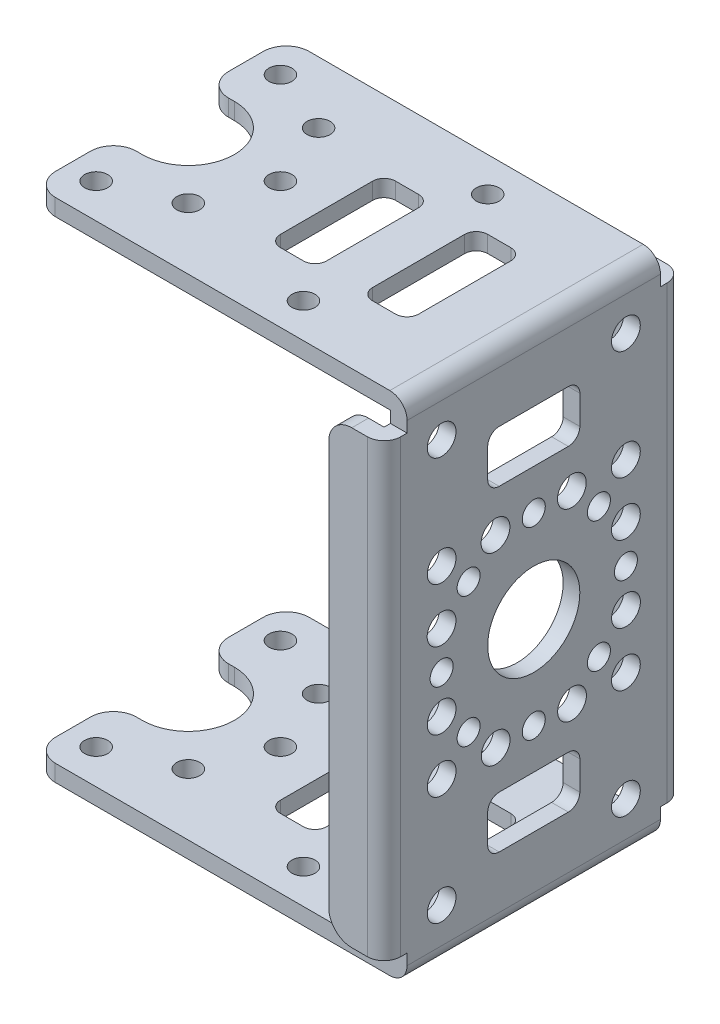
from build123d import *
from OCP.BRepAlgoAPI import BRepAlgoAPI_Cut
from OCP.TopTools import TopTools_ListOfShape

# Parameters (mm, degrees)
BOSS_EXTRUDE1_DEPTH = 11
SKETCH2_R           = 1
CUT_EXTRUDE1_DEPTH  = 49.17740653
SKETCH3_R           = 4
SKETCH3_R_2         = 1.25
SKETCH3_R_3         = 1
CUT_EXTRUDE3_DEPTH  = 56.793832843
BOSS_EXTRUDE2_DEPTH = 39.1
FILLET1_R           = 2
FILLET2_START       = -11
FILLET2_DEPTH       = 22.55
FILLET2_START_2     = -10.998352219
FILLET2_2_DEPTH     = 21.998352219
FILLET2_START_3     = -13
FILLET2_3_DEPTH     = 26
FILLET2_4_OUTLINE_W = 0.045411726
FILLET2_4_OUTLINE_H = 1
FILLET2_4_DEPTH     = 22


with BuildPart() as part:
    # Sketch1 → Boss-Extrude1 (new, symmetric)
    with BuildSketch(Plane.XY):
        Polygon((-16.25, 0), (16.25, 0), (16.25, 44), (-16.25, 44), (-16.25, 42.55), (14.8, 42.55), (14.8, 1.45), (-16.25, 1.45), align=None)
    extrude(amount=BOSS_EXTRUDE1_DEPTH, both=True)

    # Sketch2 → Cut-Extrude1 (cut, through all)
    with BuildSketch(Plane(origin=(0, 44, 0), x_dir=(1, 0, 0), z_dir=(0, 1, 0))):
        with BuildLine():
            Line((14.754588274, -11.001647781), (-14.245411726, -11.001647781))
            ThreePointArc((-14.245411726, -11.001647781), (-14.286004596, -11.001235793), (-14.326580741, -11))
            Line((-14.326580741, -11), (-16.25, -11))
            Line((-16.25, -11), (-16.25, 11))
            Line((-16.25, 11), (14.754588274, 11))
            Line((14.754588274, 11), (14.754588274, 13.363467794))
            Line((14.754588274, 13.363467794), (-19.651643458, 13.363467794))
            Line((-19.651643458, 13.363467794), (-19.651643458, -13.173756318))
            Line((-19.651643458, -13.173756318), (14.754588274, -13.173756318))
            Line((14.754588274, -13.173756318), (14.754588274, -11.001647781))
        make_face()
        with Locations(Location((-13.745411726, -8.001647781, 0), (0, 0, 180))):
            Circle(SKETCH2_R)
        with Locations(Location((-8.088557477, -5.658502031, 0), (0, 0, 180))):
            Circle(SKETCH2_R)
        with BuildLine():
            Line((1.254588274, 4.998352219), (-0.745411726, 4.998352219))
            ThreePointArc((-0.745411726, 4.998352219), (-1.452518507, 4.705459), (-1.745411726, 3.998352219))
            Line((-1.745411726, 3.998352219), (-1.745411726, -4.001647781))
            ThreePointArc((-1.745411726, -4.001647781), (-1.452518507, -4.708754562), (-0.745411726, -5.001647781))
            Line((-0.745411726, -5.001647781), (1.254588274, -5.001647781))
            ThreePointArc((1.254588274, -5.001647781), (1.961695055, -4.708754562), (2.254588274, -4.001647781))
            Line((2.254588274, -4.001647781), (2.254588274, 3.998352219))
            ThreePointArc((2.254588274, 3.998352219), (1.961695055, 4.705459), (1.254588274, 4.998352219))
        make_face()
        with BuildLine():
            Line((6.254588274, 3.998352219), (6.254588274, -4.001647781))
            ThreePointArc((6.254588274, -4.001647781), (6.547481493, -4.708754562), (7.254588274, -5.001647781))
            Line((7.254588274, -5.001647781), (9.254588274, -5.001647781))
            ThreePointArc((9.254588274, -5.001647781), (9.961695055, -4.708754562), (10.254588274, -4.001647781))
            Line((10.254588274, -4.001647781), (10.254588274, 3.998352219))
            ThreePointArc((10.254588274, 3.998352219), (9.961695055, 4.705459), (9.254588274, 4.998352219))
            Line((9.254588274, 4.998352219), (7.254588274, 4.998352219))
            ThreePointArc((7.254588274, 4.998352219), (6.547481493, 4.705459), (6.254588274, 3.998352219))
        make_face()
        with Locations(Location((4.254588274, -8.001647781, 0), (0, 0, 180))):
            Circle(SKETCH2_R)
        with Locations(Location((-5.745411726, -0.001647781, 0), (0, 0, 180))):
            Circle(SKETCH2_R)
        with Locations(Location((-8.088557477, 5.655206468, 0), (0, 0, 180))):
            Circle(SKETCH2_R)
        with Locations(Location((4.254588274, 7.998352219, 0), (0, 0, 180))):
            Circle(SKETCH2_R)
        with Locations(Location((-13.745411726, 7.998352219, 0), (0, 0, 180))):
            Circle(SKETCH2_R)
        with BuildLine():
            Line((-16.25, -11), (-14.326580741, -11))
            ThreePointArc((-14.326580741, -11), (-15.688037463, -10.386866531), (-16.245411726, -9.001647781))
            Line((-16.245411726, -9.001647781), (-16.245411726, -6.001647781))
            ThreePointArc((-16.245411726, -6.001647781), (-15.659625289, -4.587434219), (-14.245411726, -4.001647781))
            Line((-14.245411726, -4.001647781), (-13.745411726, -4.001647781))
            ThreePointArc((-13.745411726, -4.001647781), (-9.745411726, -0.001647781), (-13.745411726, 3.998352219))
            Line((-13.745411726, 3.998352219), (-14.245411726, 3.998352219))
            ThreePointArc((-14.245411726, 3.998352219), (-15.659625289, 4.584138657), (-16.245411726, 5.998352219))
            Line((-16.245411726, 5.998352219), (-16.245411726, 8.998352219))
            ThreePointArc((-16.245411726, 8.998352219), (-15.659625289, 10.412565781), (-14.245411726, 10.998352219))
            Line((-14.245411726, 10.998352219), (14.754588274, 10.998352219))
            Line((14.754588274, 10.998352219), (14.754588274, 11))
            Line((14.754588274, 11), (-16.25, 11))
            Line((-16.25, 11), (-16.25, -11))
        make_face()
    extrude(amount=-CUT_EXTRUDE1_DEPTH, mode=Mode.SUBTRACT)

    # Sketch3 → Cut-Extrude3 (cut, through all)
    with BuildSketch(Plane(origin=(16.25, 0, 0), x_dir=(0, 0, -1), z_dir=(1, 0, 0))):
        with Locations((0, 22.05)):
            Circle(SKETCH3_R)
        with BuildLine():
            Line((3, 38.05), (-3, 38.05))
            ThreePointArc((-3, 38.05), (-3.707106781, 37.757106781), (-4, 37.05))
            Line((-4, 37.05), (-4, 34.55))
            ThreePointArc((-4, 34.55), (-3.707106781, 33.842893219), (-3, 33.55))
            Line((-3, 33.55), (3, 33.55))
            ThreePointArc((3, 33.55), (3.707106781, 33.842893219), (4, 34.55))
            Line((4, 34.55), (4, 37.05))
            ThreePointArc((4, 37.05), (3.707106781, 37.757106781), (3, 38.05))
        make_face()
        with Locations((3.307494509, 30.05621399)):
            Circle(SKETCH3_R_2)
        with Locations((8, 30.05)):
            Circle(SKETCH3_R_2)
        with Locations((5.656854249, 27.706854249)):
            Circle(SKETCH3_R_3)
        with Locations((8, 25.372496408)):
            Circle(SKETCH3_R_2)
        with Locations((8, 22.05)):
            Circle(SKETCH3_R_3)
        with Locations((0, 30.05)):
            Circle(SKETCH3_R_3)
        with Locations((-3.322496408, 30.05)):
            Circle(SKETCH3_R_2)
        with Locations((-8, 30.05)):
            Circle(SKETCH3_R_2)
        with Locations((-5.656854249, 27.706854249)):
            Circle(SKETCH3_R_3)
        with Locations((-8.00621399, 25.357494509)):
            Circle(SKETCH3_R_2)
        with Locations((-8, 22.05)):
            Circle(SKETCH3_R_3)
        with BuildLine():
            Line((3, 10.55), (-3, 10.55))
            ThreePointArc((-3, 10.55), (-3.707106781, 10.257106781), (-4, 9.55))
            Line((-4, 9.55), (-4, 7.05))
            ThreePointArc((-4, 7.05), (-3.707106781, 6.342893219), (-3, 6.05))
            Line((-3, 6.05), (3, 6.05))
            ThreePointArc((3, 6.05), (3.707106781, 6.342893219), (4, 7.05))
            Line((4, 7.05), (4, 9.55))
            ThreePointArc((4, 9.55), (3.707106781, 10.257106781), (3, 10.55))
        make_face()
        with Locations((-8, 4.55)):
            Circle(SKETCH3_R_2)
        with Locations((8, 4.55)):
            Circle(SKETCH3_R_2)
        with Locations((8, 14.05)):
            Circle(SKETCH3_R_2)
        with Locations((8.00621399, 18.742505491)):
            Circle(SKETCH3_R_2)
        with Locations((5.656854249, 16.393145751)):
            Circle(SKETCH3_R_3)
        with Locations((3.322496408, 14.05)):
            Circle(SKETCH3_R_2)
        with Locations((0, 14.05)):
            Circle(SKETCH3_R_3)
        with Locations((-3.307494509, 14.04378601)):
            Circle(SKETCH3_R_2)
        with Locations((-8, 18.727503592)):
            Circle(SKETCH3_R_2)
        with Locations((-8, 14.05)):
            Circle(SKETCH3_R_2)
        with Locations((8, 39.55)):
            Circle(SKETCH3_R_2)
        with Locations((-8, 39.55)):
            Circle(SKETCH3_R_2)
        with Locations((-5.656854249, 16.393145751)):
            Circle(SKETCH3_R_3)
    extrude(amount=-CUT_EXTRUDE3_DEPTH, mode=Mode.SUBTRACT)

    # Sketch4 → Boss-Extrude2 (add)
    with BuildSketch(Plane(origin=(0, 2.45, 0), x_dir=(1, 0, 0), z_dir=(0, 1, 0))):
        with BuildLine():
            Line((16.25, -11), (16.25, -11.55))
            ThreePointArc((16.25, -11.55), (15.825304833, -12.575304833), (14.8, -13))
            Line((14.8, -13), (11.45, -13))
            Line((11.45, -13), (11.45, -11.55))
            Line((11.45, -11.55), (14.8, -11.55))
            Line((14.8, -11.55), (14.8, -11))
            Line((14.8, -11), (16.25, -11))
        make_face()
    boss_extrude2 = extrude(amount=BOSS_EXTRUDE2_DEPTH)

    # Mirror1: Boss-Extrude2 across plane
    add(boss_extrude2.mirror(Plane.XY))

    # Fillet1
    fillet1_edges = [part.edges().sort_by_distance(p)[0] for p in [
        (11.45, 2.45, 12.275),
        (11.45, 41.55, 12.275),
        (11.45, 2.45, -12.275),
        (11.45, 41.55, -12.275),
    ]]
    fillet(fillet1_edges, radius=FILLET1_R)


with BuildPart() as fillet2_tool:
    # Fillet2: read off the stored shape, not the designer's step
    # Fillet2 outline → Fillet2 (new body)
    with BuildSketch(Plane.XY.offset(FILLET2_START)):
        with BuildLine():
            ThreePointArc((14.754588253, 43.999992983), (15.812281126, 43.559036737), (16.25, 42.5))
            Line((16.25, 42.5), (16.25, 44))
            Line((16.25, 44), (14.754588253, 43.999992983))
        make_face()
        with BuildLine():
            ThreePointArc((16.25, 1.5), (15.812281126, 0.440963263), (14.754588253, 7.017e-06))
            Line((14.754588253, 7.017e-06), (16.25, 0))
            Line((16.25, 0), (16.25, 1.5))
        make_face()
    extrude(amount=FILLET2_DEPTH)


with BuildPart() as part_1:
    add(part.part)

    # Fillet2: cut by fillet2_tool, with a tolerance
    fillet2_stock = TopTools_ListOfShape()
    fillet2_stock.Append(part_1.part.wrapped)
    fillet2_tools = TopTools_ListOfShape()
    fillet2_tools.Append(fillet2_tool.part.wrapped)
    fillet2_cut = BRepAlgoAPI_Cut()
    fillet2_cut.SetArguments(fillet2_stock)
    fillet2_cut.SetTools(fillet2_tools)
    fillet2_cut.SetFuzzyValue(0.00001)
    fillet2_cut.Build()
    add(Compound.cast(fillet2_cut.Shape()).solids(), mode=Mode.REPLACE)


with BuildPart() as fillet2_2_tool:
    # Fillet2 2 outline → Fillet2 2 (new body)
    with BuildSketch(Plane.XY.offset(FILLET2_START_2)):
        with BuildLine():
            Line((13.3, 1.45), (14.8, 1.45))
            Line((14.8, 1.45), (14.8, 2.95))
            ThreePointArc((14.8, 2.95), (14.360660172, 1.889339828), (13.3, 1.45))
        make_face()
    extrude(amount=FILLET2_2_DEPTH)


with BuildPart() as part_2:
    add(part_1.part)


with BuildPart() as part_3:
    # Fillet2 2: joined with fillet2_2_tool
    add(part_2.part.fuse(fillet2_2_tool.part, tol=0.00001))


with BuildPart() as fillet2_3_tool:
    # Fillet2 3 outline → Fillet2 3 (new body)
    with BuildSketch(Plane.XY.offset(FILLET2_START_3)):
        with BuildLine():
            Line((14.714213563, 2.45), (14.8, 2.45))
            Line((14.8, 2.45), (14.8, 2.95))
            ThreePointArc((14.8, 2.95), (14.77839784, 2.696347032), (14.714213563, 2.45))
        make_face()
    extrude(amount=FILLET2_3_DEPTH)


with BuildPart() as part_4:
    add(part_3.part)


with BuildPart() as part_5:
    # Fillet2 3: joined with fillet2_3_tool
    add(part_4.part.fuse(fillet2_3_tool.part, tol=0.00001))


with BuildPart() as fillet2_4_tool:
    # Fillet2 4 outline → Fillet2 4 (new body)
    with BuildSketch(Plane.XY.offset(FILLET2_START)):
        with Locations((14.777294137, 1.95)):
            Rectangle(FILLET2_4_OUTLINE_W, FILLET2_4_OUTLINE_H)
    extrude(amount=FILLET2_4_DEPTH)


with BuildPart() as part_6:
    add(part_5.part)


with BuildPart() as part_7:
    # Fillet2 4: joined with fillet2_4_tool
    add(part_6.part.fuse(fillet2_4_tool.part, tol=0.00001))


solid = part_7.part
